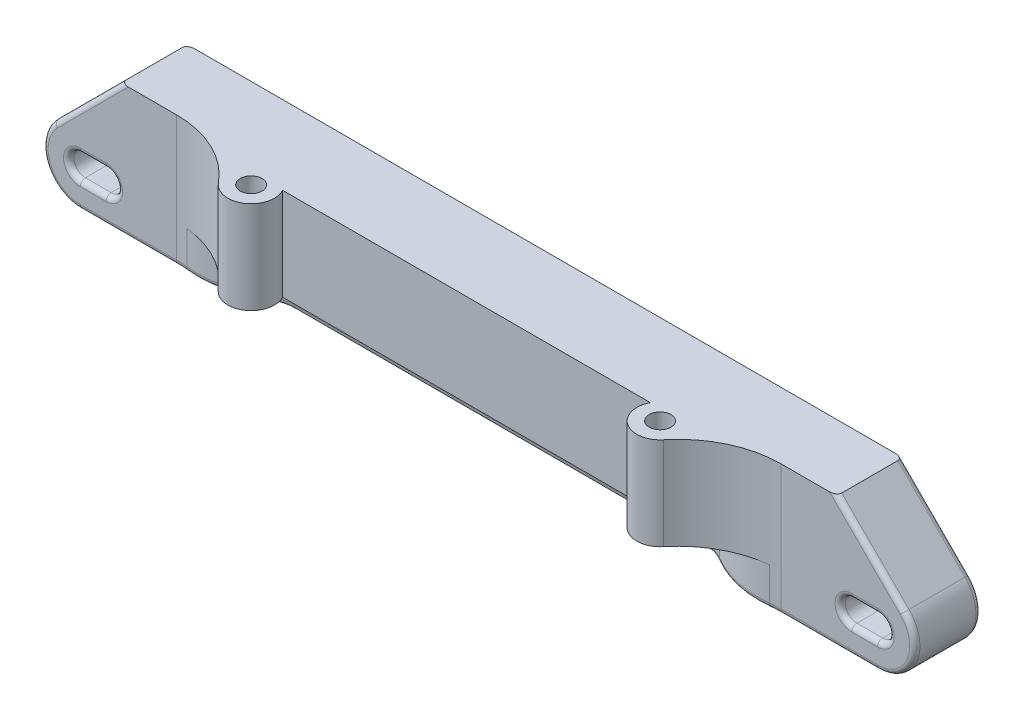
from build123d import *

# Parameters (mm, degrees)
SKETCH1_R                 = 2.125
MAIN_DEPTH                = 18
POWE_SUPPLY_MOUNT_DEPTH   = 12.88
BOTTOM_PLATE_CAVITY_DEPTH = 7.45
FILLET1_DEPTH             = 18
FILLET1_START             = -7.45
FILLET1_2_DEPTH           = 9.35116
FILLET2_R                 = 20
FILLET3_R                 = 1


with BuildPart() as part:
    # Sketch1 → Main (new body)
    with BuildSketch(Plane(origin=(0, 0, 0), x_dir=(1, 0, 0), z_dir=(0, 1, 0))):
        with BuildLine():
            Line((-39.75, 4.525), (39.75, 4.525))
            ThreePointArc((39.75, 4.525), (42.08023604, -3.878869036), (35.755003129, 2.125))
            Line((35.755003129, 2.125), (-35.755003129, 2.125))
            ThreePointArc((-35.755003129, 2.125), (-42.08023604, -3.878869036), (-39.75, 4.525))
        make_face()
        with Locations(Location((-39.75, 0, 0), (0, 0, 270))):
            Circle(SKETCH1_R, mode=Mode.SUBTRACT)
        with Locations(Location((39.75, 0, 0), (0, 0, 270))):
            Circle(SKETCH1_R, mode=Mode.SUBTRACT)
    extrude(amount=MAIN_DEPTH)

    # Sketch2 → Powe Supply Mount (add)
    with BuildSketch(Plane(origin=(0, 0, -4.525), x_dir=(-1, 0, 0), z_dir=(0, 0, -1))):
        with BuildLine():
            Line((-69.553048327, 18), (-82.626524164, 4.926524164))
            ThreePointArc((-82.626524164, 4.926524164), (-84.198126611, -2.974454885), (-77.5, -7.45))
            Line((-77.5, -7.45), (77.5, -7.45))
            ThreePointArc((77.5, -7.45), (84.198126611, -2.974454885), (82.626524164, 4.926524164))
            Line((82.626524164, 4.926524164), (69.553048327, 18))
            Line((69.553048327, 18), (-69.553048327, 18))
        make_face()
        with BuildLine():
            Line((77.5, -2.45), (72.5, -2.45))
            ThreePointArc((72.5, -2.45), (70.25, -0.2), (72.5, 2.05))
            Line((72.5, 2.05), (77.5, 2.05))
            ThreePointArc((77.5, 2.05), (79.75, -0.2), (77.5, -2.45))
        make_face(mode=Mode.SUBTRACT)
        with BuildLine():
            ThreePointArc((-77.5, -2.45), (-79.75, -0.2), (-77.5, 2.05))
            Line((-77.5, 2.05), (-72.5, 2.05))
            ThreePointArc((-72.5, 2.05), (-70.25, -0.2), (-72.5, -2.45))
            Line((-72.5, -2.45), (-77.5, -2.45))
        make_face(mode=Mode.SUBTRACT)
    extrude(amount=POWE_SUPPLY_MOUNT_DEPTH)

    # Sketch4 → Bottom Plate Cavity (cut)
    with BuildSketch(Plane.XZ.offset(7.45)):
        with BuildLine():
            ThreePointArc((-46.82703151, -4.525), (-43.784228551, -7.367835503), (-39.75, -8.4))
            Line((-39.75, -8.4), (39.75, -8.4))
            ThreePointArc((39.75, -8.4), (43.784228551, -7.367835503), (46.82703151, -4.525))
            Line((46.82703151, -4.525), (-46.82703151, -4.525))
        make_face()
    extrude(amount=-BOTTOM_PLATE_CAVITY_DEPTH, mode=Mode.SUBTRACT)

    # Fillet1: read off the stored shape, not the designer's step
    # Fillet1 outline → Fillet1 (add)
    with BuildSketch(Plane(origin=(0, 0, 0), x_dir=(1, 0, 0), z_dir=(0, 1, 0))):
        with BuildLine():
            ThreePointArc((-58.77629759, 4.525), (-50.185474428, 2.585945639), (-43.260458577, -2.855224261))
            ThreePointArc((-43.260458577, -2.855224261), (-43.836288951, 1.943673741), (-39.75, 4.525))
            Line((-39.75, 4.525), (-58.77629759, 4.525))
        make_face()
        with BuildLine():
            Line((58.77629759, 4.525), (39.75, 4.525))
            ThreePointArc((39.75, 4.525), (43.836288951, 1.943673741), (43.260458577, -2.855224261))
            ThreePointArc((43.260458577, -2.855224261), (50.185474428, 2.585945639), (58.77629759, 4.525))
        make_face()
    extrude(amount=FILLET1_DEPTH)

    # Fillet1 2 outline → Fillet1 2 (add)
    with BuildSketch(Plane(origin=(0, 0, 0), x_dir=(1, 0, 0), z_dir=(0, 1, 0)).offset(FILLET1_START)):
        with BuildLine():
            ThreePointArc((-58.77629759, 4.525), (-53.181472877, 3.726508701), (-48.033390049, 1.394793642))
            ThreePointArc((-48.033390049, 1.394793642), (-47.588060064, 3.020730777), (-46.82703151, 4.525))
            Line((-46.82703151, 4.525), (-58.77629759, 4.525))
        make_face()
        with BuildLine():
            Line((58.77629759, 4.525), (46.82703151, 4.525))
            ThreePointArc((46.82703151, 4.525), (47.588060064, 3.020730777), (48.033390048, 1.394793643))
            ThreePointArc((48.033390048, 1.394793643), (53.181472877, 3.726508701), (58.77629759, 4.525))
        make_face()
    extrude(amount=FILLET1_2_DEPTH)

    # Fillet2
    # the kernel refuses this fillet: 20 mm, written as the material it takes off along each edge
    with BuildSketch(Plane(origin=(-48.033390049, -30.199313713, -1.394793642), x_dir=(-0.9435700028577678, 0, -0.33117314158456784), z_dir=(0, 1, 0))) as fillet2_piece_1:
        with BuildLine():
            CenterArc((13.649588228, -19.475593676), FILLET2_R, 103.14952704, 37.392760126)
            ThreePointArc((-1.79228839, -6.765422689), (-0.157980704, -3.57826481), (0, 0))
            ThreePointArc((0, 0), (4.549862743, -0.524406324), (9.099725485, 0))
        make_face()
    extrude(amount=30.199313713, mode=Mode.SUBTRACT)
    with BuildSketch(Plane(origin=(48.033390048, -30.199313709, -1.394793643), x_dir=(0.9435700028837163, 0, -0.3311731415106358), z_dir=(0, 1, 0))) as fillet2_piece_2:
        with BuildLine():
            CenterArc((13.649588223, 19.475593677), FILLET2_R, 219.457712868, 37.392760103)
            ThreePointArc((-1.792288388, 6.76542268), (-0.157980703, 3.578264806), (0, 0))
            ThreePointArc((0, 0), (4.549862742, 0.524406323), (9.099725484, 0))
        make_face()
    extrude(amount=30.199313709, mode=Mode.SUBTRACT)

    # Fillet3
    fillet3_edges = [part.edges().sort_by_distance(p)[0] for p in [
        (-42.009088261, -7.45, -8.090520393),
        (-57.696382402, -7.45, -4.495823297),
        (50.13213176, -7.45, -4.7662832),
        (-50.132131759, -7.45, -4.766283202),
        (-70.25, -0.2, -17.405),
        (-75, 2.05, -17.405),
        (-79.75, -0.2, -17.405),
        (70.25, -0.2, -17.405),
        (75, -2.45, -17.405),
        (79.75, -0.2, -17.405),
        (76.089786245, 11.463262082, -17.405),
        (84.198126611, -2.974454885, -4.525),
        (68.138148795, -7.45, -4.525),
        (-84.198126611, -2.974454885, -4.525),
        (75, 2.05, -4.525),
        (-76.089786245, 11.463262082, -4.525),
        (-75, -2.45, -4.525),
        (84.198126611, -2.974454885, -17.405),
        (0, -7.45, -17.405),
        (-84.198126611, -2.974454885, -17.405),
        (-76.089786245, 11.463262082, -17.405),
        (75, 2.05, -17.405),
        (-75, -2.45, -17.405),
        (76.089786245, 11.463262082, -4.525),
        (70.25, -0.2, -4.525),
        (79.75, -0.2, -4.525),
        (75, -2.45, -4.525),
        (-70.25, -0.2, -4.525),
        (-79.75, -0.2, -4.525),
        (-75, 2.05, -4.525),
        (0, -7.45, -8.4),
        (42.009088264, -7.45, -8.090520392),
        (-68.138148795, -7.45, -4.525),
        (57.696382401, -7.45, -4.495823297),
    ]]
    fillet(fillet3_edges, radius=FILLET3_R)


solid = part.part
